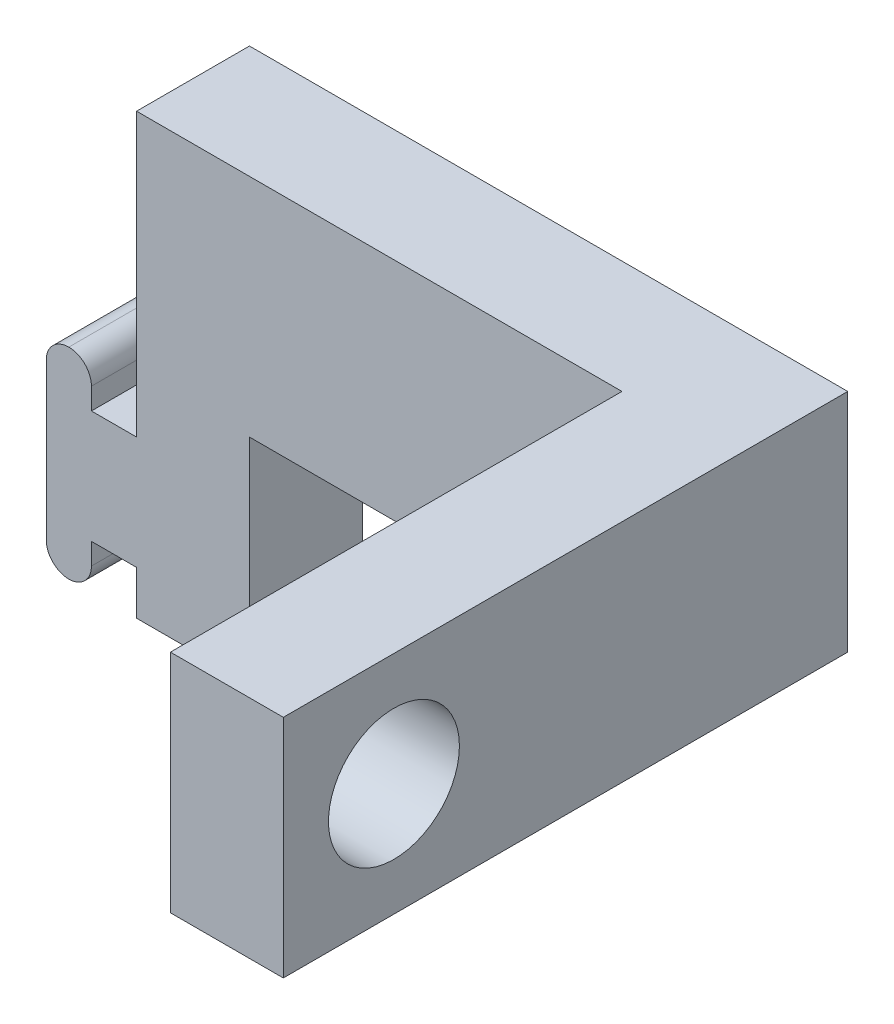
from build123d import *

# Parameters (mm, degrees)
BOSS_EXTRUDE1_DEPTH     = 12.7
BOSS_EXTRUDE2_DEPTH     = 6.35
FILLET1_R               = 1.27
FILLET2_R               = 1.27
CUT_EXTRUDE1_DEPTH      = 52.669649941
CUT_EXTRUDE1_DEPTH_BACK = 52.669649941
SKETCH5_R               = 3.683


with BuildPart() as part:
    # Sketch1 → Boss-Extrude1 (new body)
    with BuildSketch(Plane(origin=(0, 0, 0), x_dir=(1, 0, 0), z_dir=(0, 1, 0))):
        Polygon((0, 0), (0, 31.75), (-22.86, 31.75), (-22.86, 25.4), (-6.35, 25.4), (-6.35, 0), align=None)
    extrude(amount=BOSS_EXTRUDE1_DEPTH)

    # Sketch3 → Boss-Extrude2 (add)
    with BuildSketch(Plane(origin=(0, 0, -31.75), x_dir=(-1, 0, 0), z_dir=(0, 0, -1))):
        Polygon((22.86, 12.7), (33.655, 12.7), (33.655, -3.175), (36.195, -3.175), (36.195, -0.6985), (38.735, -0.6985), (38.735, -12.0015), (36.195, -12.0015), (36.195, -9.525), (33.655, -9.525), (33.655, -12.0015), (27.305, -12.0015), (27.305, 0), (22.86, 0), align=None)
    extrude(amount=-BOSS_EXTRUDE2_DEPTH)

    # Fillet1
    fillet1_edges = [part.edges().sort_by_distance(p)[0] for p in [
        (-36.195, -0.6985, -28.575),
    ]]
    fillet(fillet1_edges, radius=FILLET1_R)

    # Fillet2
    fillet2_edges = [part.edges().sort_by_distance(p)[0] for p in [
        (-36.195, -12.0015, -28.575),
        (-38.735, -12.0015, -28.575),
        (-38.735, -0.6985, -28.575),
    ]]
    fillet(fillet2_edges, radius=FILLET2_R - 0.0001)  # a hair under: the kernel refuses the full size

    # Sketch5 → Cut-Extrude1 (cut, two sides: drawn at the far end of the back side and taken through both)
    with BuildSketch(Plane(origin=(0, 0, 0), x_dir=(0, 0, -1), z_dir=(1, 0, 0)).offset(-CUT_EXTRUDE1_DEPTH_BACK)):
        with Locations((6.223, 6.35)):
            Circle(SKETCH5_R)
    extrude(amount=CUT_EXTRUDE1_DEPTH + CUT_EXTRUDE1_DEPTH_BACK, mode=Mode.SUBTRACT)


solid = part.part
